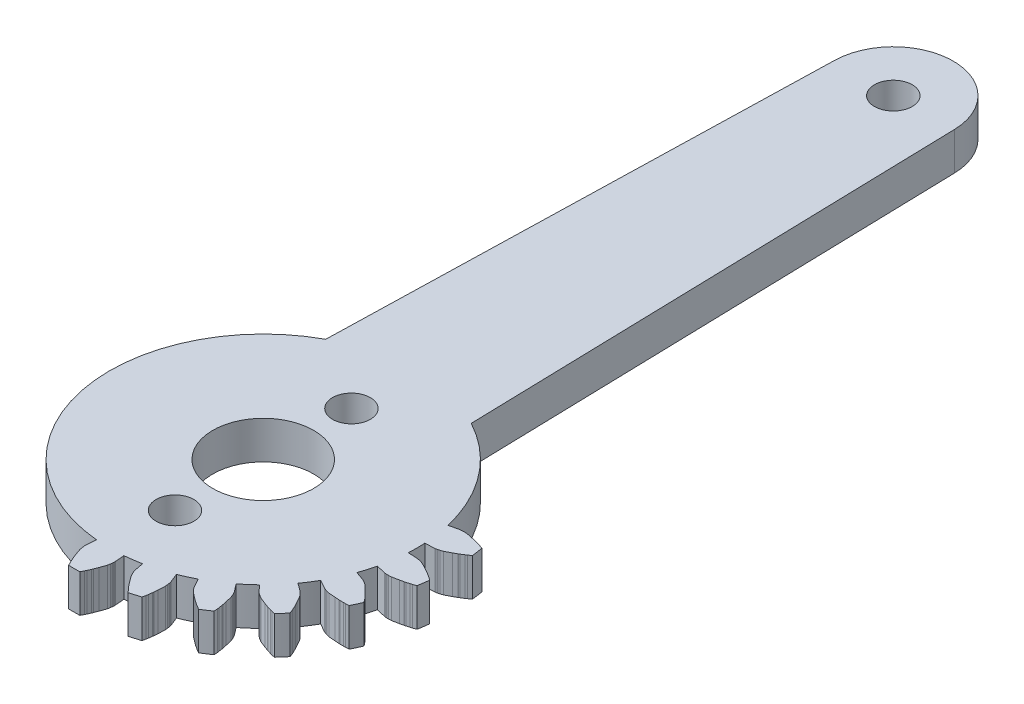
from build123d import *

# Parameters (mm, degrees)
EXTRUDE_1_DEPTH          = 3
SKETCH_2_R               = 12.1875
SKETCH_2_R_2             = 4
SKETCH_2_R_3             = 1.5
EXTRUDE_2_DEPTH          = 3
PATTERN_CIRCULAR_2_COUNT = 22
SKETCH_5_R               = 1.5
EXTRUDE_3_DEPTH          = 3
CUT_EXTRUDE_1_DEPTH      = 3


with BuildPart() as part:
    # 草图1 → 凸台-拉伸1 (new body)
    with BuildSketch(Plane(origin=(0, 0, 0), x_dir=(1, 0, 0), z_dir=(0, 1, 0))):
        with BuildLine():
            Line((39.751048724, 40.522419067), (39.686554084, 41.267856945))
            Line((39.686554084, 41.267856945), (39.685130687, 41.328679419))
            Line((39.685130687, 41.328679419), (39.685864546, 41.357680475))
            Line((39.685864546, 41.357680475), (39.691646479, 41.452849434))
            Line((39.691646479, 41.452849434), (39.692944909, 41.469767126))
            Line((39.692944909, 41.469767126), (39.696597708, 41.504162575))
            Line((39.696597708, 41.504162575), (39.712000694, 41.625842063))
            Line((39.712000694, 41.625842063), (39.748222719, 41.824728347))
            ThreePointArc((39.748222719, 41.824728347), (39.836788564, 42.08141601), (39.929464983, 42.336648348))
            Line((39.929464983, 42.336648348), (40.043958498, 42.644244873))
            Line((40.043958498, 42.644244873), (40.045380324, 42.647784709))
            Line((40.045380324, 42.647784709), (40.085544561, 42.739845233))
            Line((40.085544561, 42.739845233), (40.199519113, 42.997146045))
            ThreePointArc((40.199519113, 42.997146045), (40.23147084, 43.066367201), (40.265346714, 43.134667321))
            ThreePointArc((40.265346714, 43.134667321), (40.328973011, 43.256230012), (40.394481299, 43.376788951))
            ThreePointArc((40.394481299, 43.376788951), (40.835680824, 43.383278913), (41.276880349, 43.376788932))
            ThreePointArc((41.276880349, 43.376788932), (41.342388638, 43.256229993), (41.406014935, 43.134667302))
            ThreePointArc((41.406014935, 43.134667302), (41.439890808, 43.066367181), (41.471842535, 42.997146026))
            Line((41.471842535, 42.997146026), (41.585817087, 42.739845214))
            Line((41.585817087, 42.739845214), (41.625981324, 42.647784689))
            Line((41.625981324, 42.647784689), (41.62740315, 42.644244854))
            Line((41.62740315, 42.644244854), (41.741896665, 42.336648329))
            ThreePointArc((41.741896665, 42.336648329), (41.834572754, 42.081415998), (41.923138271, 41.824728347))
            Line((41.923138271, 41.824728347), (41.959360296, 41.625842063))
            Line((41.959360296, 41.625842063), (41.974763282, 41.504162575))
            Line((41.974763282, 41.504162575), (41.978416081, 41.469767126))
            Line((41.978416081, 41.469767126), (41.979714511, 41.452849434))
            Line((41.979714511, 41.452849434), (41.985496444, 41.357680475))
            Line((41.985496444, 41.357680475), (41.986230303, 41.328679419))
            Line((41.986230303, 41.328679419), (41.984806906, 41.267856945))
            Line((41.984806906, 41.267856945), (41.920312266, 40.522419067))
            ThreePointArc((41.920312266, 40.522419067), (40.835680495, 40.570778645), (39.751048724, 40.522419067))
        make_face()
    extrude_1 = extrude(amount=EXTRUDE_1_DEPTH)

    # 草图2 → 凸台-拉伸2 (add)
    with BuildSketch(Plane.XZ):
        with Locations((40.835680495, -28.383278645)):
            Circle(SKETCH_2_R)
        with Locations((40.835680495, -28.383278645)):
            Circle(SKETCH_2_R_2, mode=Mode.SUBTRACT)
        with Locations((40.835680495, -21.383278645)):
            Circle(SKETCH_2_R_3, mode=Mode.SUBTRACT)
        with Locations((40.835680495, -35.383278645)):
            Circle(SKETCH_2_R_3, mode=Mode.SUBTRACT)
    extrude(amount=-EXTRUDE_2_DEPTH)

    # 阵列(圆周)2: 凸台-拉伸1 ×22 about axis
    pattern_circular_2_axis = Axis((40.835680495, 3, -28.383278645), (0, -1, 0))
    for i in range(1, PATTERN_CIRCULAR_2_COUNT):
        add(extrude_1.rotate(pattern_circular_2_axis, i * 360 / PATTERN_CIRCULAR_2_COUNT))

    # 草图5 → 凸台-拉伸3 (add)
    with BuildSketch(Plane.XZ):
        with BuildLine():
            Line((45.585680495, -78.506878604), (46.610680495, -39.115684305))
            ThreePointArc((46.610680495, -39.115684305), (40.835680495, -40.570778645), (35.060680495, -39.115684305))
            Line((35.060680495, -39.115684305), (36.085680495, -78.506878604))
            ThreePointArc((36.085680495, -78.506878604), (40.835680495, -83.134886473), (45.585680495, -78.506878604))
        make_face()
        with Locations((40.835680495, -78.383278645)):
            Circle(SKETCH_5_R, mode=Mode.SUBTRACT)
    extrude(amount=-EXTRUDE_3_DEPTH)

    # 草图7 → 切除-拉伸1 (cut)
    with BuildSketch(Plane.XZ):
        with BuildLine():
            Line((35.060680495, -39.115684305), (35.068180495, -39.403912537))
            Line((35.068180495, -39.403912537), (34.836458203, -39.843740301))
            Line((34.836458203, -39.843740301), (33.621076182, -45.069775655))
            Line((33.621076182, -45.069775655), (23.29469854, -35.421541283))
            Line((23.29469854, -35.421541283), (25.189109524, -22.168156693))
            Line((25.189109524, -22.168156693), (31.430752441, -11.204000881))
            Line((31.430752441, -11.204000881), (37.969616449, -9.816969122))
            Line((37.969616449, -9.816969122), (39.751048724, -16.244138224))
            ThreePointArc((39.751048724, -16.244138224), (28.89664611, -25.93488852), (35.060680495, -39.115684305))
        make_face()
        with BuildLine():
            Line((46.610680495, -39.115684305), (46.603180496, -39.403912537))
            Line((46.603180496, -39.403912537), (47.014217925, -42.363226189))
            Line((47.014217925, -42.363226189), (53.527706743, -41.712847694))
            Line((53.527706743, -41.712847694), (55.437535773, -32.439444059))
            Line((55.437535773, -32.439444059), (52.32840334, -32.439444059))
            ThreePointArc((52.32840334, -32.439444059), (50.09238666, -36.31098621), (46.610680495, -39.115684305))
        make_face()
    extrude(amount=-CUT_EXTRUDE_1_DEPTH, mode=Mode.SUBTRACT)


solid = part.part
